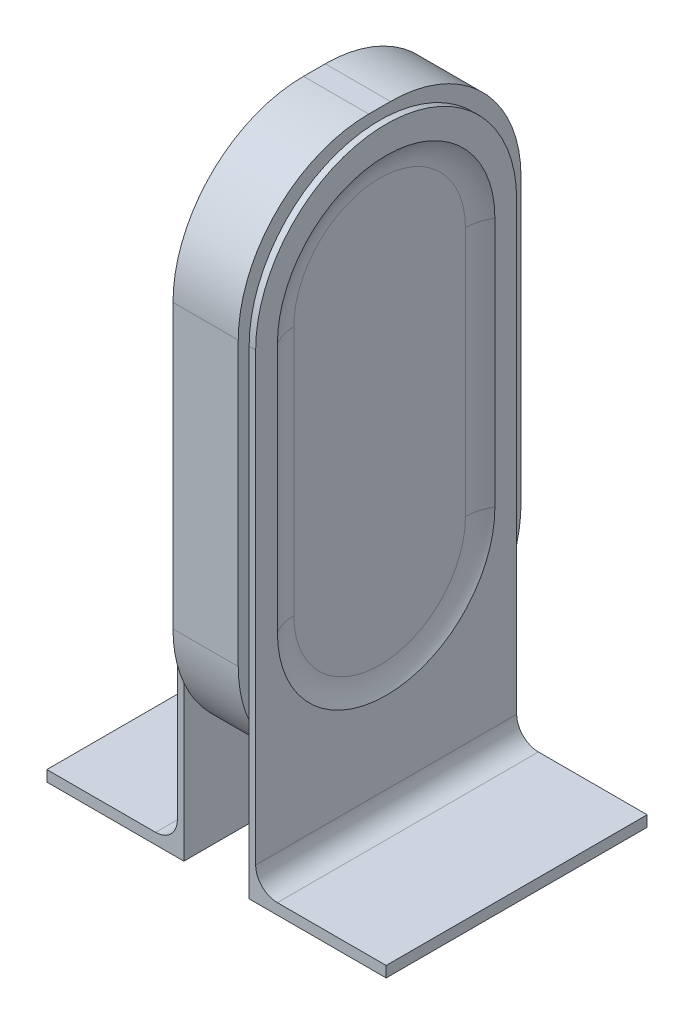
from build123d import *

# Parameters (mm, degrees)
BOSS_EXTRUDE1_DEPTH = 15
BOSS_EXTRUDE2_DEPTH = 3
FILLET1_R           = 20
SKETCH4_W           = 60
SKETCH4_H           = 120
BOSS_EXTRUDE3_DEPTH = 5
BOSS_EXTRUDE4_START = -30
BOSS_EXTRUDE4_DEPTH = 3
FILLET2_R           = 20
FILLET4_R           = 10
BOSS_EXTRUDE5_START = -5
BOSS_EXTRUDE5_DEPTH = 120


with BuildPart() as part:
    # Sketch1 → Boss-Extrude1 (new, symmetric)
    with BuildSketch(Plane(origin=(0, 0, 0), x_dir=(0, 0, -1), z_dir=(1, 0, 0))):
        with BuildLine():
            Line((5, 125), (-5, 125))
            ThreePointArc((-5, 125), (-47.426406871, 107.426406871), (-65, 65))
            Line((-65, 65), (-65, -65))
            ThreePointArc((-65, -65), (-47.426406871, -107.426406871), (-5, -125))
            Line((-5, -125), (5, -125))
            ThreePointArc((5, -125), (47.426406871, -107.426406871), (65, -65))
            Line((65, -65), (65, 65))
            ThreePointArc((65, 65), (47.426406871, 107.426406871), (5, 125))
        make_face()
    extrude(amount=BOSS_EXTRUDE1_DEPTH, both=True)

    # Sketch3 → Boss-Extrude2 (add)
    with BuildSketch(Plane(origin=(15, 0, 0), x_dir=(0, 0, -1), z_dir=(1, 0, 0))):
        with BuildLine():
            Line((-60, -60), (-60, 60))
            ThreePointArc((-60, 60), (0, 120), (60, 60))
            Line((60, 60), (60, -60))
            Line((60, -60), (60, -160))
            Line((60, -160), (-60, -160))
            Line((-60, -160), (-60, -60))
        make_face()
        with BuildLine():
            Line((-50, -57.5), (-50, 57.5))
            ThreePointArc((-50, 57.5), (0, 107.5), (50, 57.5))
            Line((50, 57.5), (50, -57.5))
            ThreePointArc((50, -57.5), (0, -107.5), (-50, -57.5))
        make_face(mode=Mode.SUBTRACT)
    extrude(amount=BOSS_EXTRUDE2_DEPTH)

    # Fillet1
    # the kernel refuses this fillet: 20 mm, written as the material it adds along each edge
    with BuildSketch(Plane(origin=(15, 57.5, -50), x_dir=(1, 0, 0), z_dir=(0, -1, 0)), Plane(origin=(15, -57.5, 50), x_dir=(1, 0, 0), z_dir=(0, 1, 0))) as fillet1_piece_1:
        with BuildLine():
            CenterArc((20, 10.535653753), FILLET1_R, 180, 31.788330617)
            Line((0, 10.535653753), (-0.4, 10.535653753))
            Line((-0.4, 10.535653753), (-0.4, 0))
            Line((-0.4, 0), (0, -0.4))
            ThreePointArc((0, -0.4), (1.5, -0.4), (2.66, -0.210713075))
            Line((2.66, -0.210713075), (3, 0))
        make_face()
    extrude(amount=115)
    with BuildSketch(Plane(origin=(15, -57.5, 0), x_dir=(0, 0, -1), z_dir=(0, 1, 0))) as fillet1_piece_2:
        with BuildLine():
            CenterArc((39.464346247, -20), FILLET1_R, 58.211669383, 31.788330617)
            Line((39.464346247, 0), (39.464346247, 0.4))
            Line((39.464346247, 0.4), (50, 0.4))
            Line((50, 0.4), (50.4, 0))
            ThreePointArc((50.4, 0), (50.4, -1.5), (50.210713075, -2.66))
            Line((50.210713075, -2.66), (50, -3))
        make_face()
    revolve(axis=Axis((15, -57.5, 0), (-1, 0, 0)), revolution_arc=180)
    with BuildSketch(Plane(origin=(15, 57.5, 0), x_dir=(0, 0, 1), z_dir=(0, -1, 0))) as fillet1_piece_3:
        with BuildLine():
            CenterArc((39.464346247, -20), FILLET1_R, 58.211669383, 31.788330617)
            Line((39.464346247, 0), (39.464346247, 0.4))
            Line((39.464346247, 0.4), (50, 0.4))
            Line((50, 0.4), (50.4, 0))
            ThreePointArc((50.4, 0), (50.4, -1.5), (50.210713075, -2.66))
            Line((50.210713075, -2.66), (50, -3))
        make_face()
    revolve(axis=Axis((15, 57.5, 0), (-1, 0, 0)), revolution_arc=180)

    # Sketch4 → Boss-Extrude3 (add)
    with BuildSketch(Plane.XZ.offset(160)):
        with Locations((48, 0)):
            Rectangle(SKETCH4_W, SKETCH4_H)
        with Locations((-48, 0)):
            Rectangle(SKETCH4_W, SKETCH4_H)
    extrude(amount=-BOSS_EXTRUDE3_DEPTH)


with BuildPart() as boss_extrude3_piece_1:
    # of the separate pieces the step leaves, piece 1, a body of its own (boss_extrude3_pieces)
    add(part.part.solids().sort_by_distance((18, 57.5, 50))[0])

    # Sketch3<4> → Boss-Extrude4 (add)
    with BuildSketch(Plane(origin=(15, 0, 0), x_dir=(0, 0, -1), z_dir=(1, 0, 0)).offset(BOSS_EXTRUDE4_START)):
        with BuildLine():
            Line((-60, -60), (-60, 60))
            ThreePointArc((-60, 60), (0, 120), (60, 60))
            Line((60, 60), (60, -60))
            Line((60, -60), (60, -160))
            Line((60, -160), (-60, -160))
            Line((-60, -160), (-60, -60))
        make_face()
        with BuildLine():
            Line((-50, -57.5), (-50, 57.5))
            ThreePointArc((-50, 57.5), (0, 107.5), (50, 57.5))
            Line((50, 57.5), (50, -57.5))
            ThreePointArc((50, -57.5), (0, -107.5), (-50, -57.5))
        make_face(mode=Mode.SUBTRACT)
    extrude(amount=-BOSS_EXTRUDE4_DEPTH)

    # Fillet2
    # the kernel refuses this fillet: 20 mm, written as the material it adds along each edge
    with BuildSketch(Plane(origin=(-15, -57.5, 0), x_dir=(0, 0, -1), z_dir=(0, 1, 0))) as fillet2_piece_1:
        with BuildLine():
            CenterArc((39.464346247, 20), FILLET2_R, 270, 31.788330617)
            Line((39.464346247, 0), (39.464346247, -0.4))
            Line((39.464346247, -0.4), (50, -0.4))
            Line((50, -0.4), (50.4, 0))
            ThreePointArc((50.4, 0), (50.4, 1.5), (50.210713075, 2.66))
            Line((50.210713075, 2.66), (50, 3))
        make_face()
    revolve(axis=Axis((-15, -57.5, 0), (-1, 0, 0)), revolution_arc=180)
    with BuildSketch(Plane(origin=(-15, -57.5, 50), x_dir=(-1, 0, 0), z_dir=(0, 1, 0)), Plane(origin=(-15, 57.5, -50), x_dir=(-1, 0, 0), z_dir=(0, -1, 0))) as fillet2_piece_2:
        with BuildLine():
            CenterArc((20, -10.535653753), FILLET2_R, 148.211669383, 31.788330617)
            Line((0, -10.535653753), (-0.4, -10.535653753))
            Line((-0.4, -10.535653753), (-0.4, 0))
            Line((-0.4, 0), (0, 0.4))
            ThreePointArc((0, 0.4), (1.5, 0.4), (2.66, 0.210713075))
            Line((2.66, 0.210713075), (3, 0))
        make_face()
    extrude(amount=115)
    with BuildSketch(Plane(origin=(-15, 57.5, 0), x_dir=(0, 0, 1), z_dir=(0, -1, 0))) as fillet2_piece_3:
        with BuildLine():
            CenterArc((39.464346247, 20), FILLET2_R, 270, 31.788330617)
            Line((39.464346247, 0), (39.464346247, -0.4))
            Line((39.464346247, -0.4), (50, -0.4))
            Line((50, -0.4), (50.4, 0))
            ThreePointArc((50.4, 0), (50.4, 1.5), (50.210713075, 2.66))
            Line((50.210713075, 2.66), (50, 3))
        make_face()
    revolve(axis=Axis((-15, 57.5, 0), (-1, 0, 0)), revolution_arc=180)

    # Fillet4
    fillet4_edges = [boss_extrude3_piece_1.edges().sort_by_distance(p)[0] for p in [
        (18, -155, 0),
    ]]
    fillet(fillet4_edges, radius=FILLET4_R)



with BuildPart() as boss_extrude3_piece_2:
    # of the separate pieces the step leaves, piece 2, a body of its own (boss_extrude3_pieces)
    add(part.part.solids().sort_by_distance((-18, -160, 60))[0])


with BuildPart() as boss_extrude3_piece_1_1:
    add(boss_extrude3_piece_1.part)

    add(boss_extrude3_piece_2.part)  # Boss-Extrude5 merges Boss-Extrude3 piece 2
    # Sketch5 → Boss-Extrude5 (add)
    with BuildSketch(Plane.XY.offset(65).offset(BOSS_EXTRUDE5_START)):
        with BuildLine():
            Line((-28, -155), (-18, -155))
            Line((-18, -155), (-18, -145))
            ThreePointArc((-18, -145), (-20.928932188, -152.071067812), (-28, -155))
        make_face()
    extrude(amount=-BOSS_EXTRUDE5_DEPTH)


solid = boss_extrude3_piece_1_1.part
